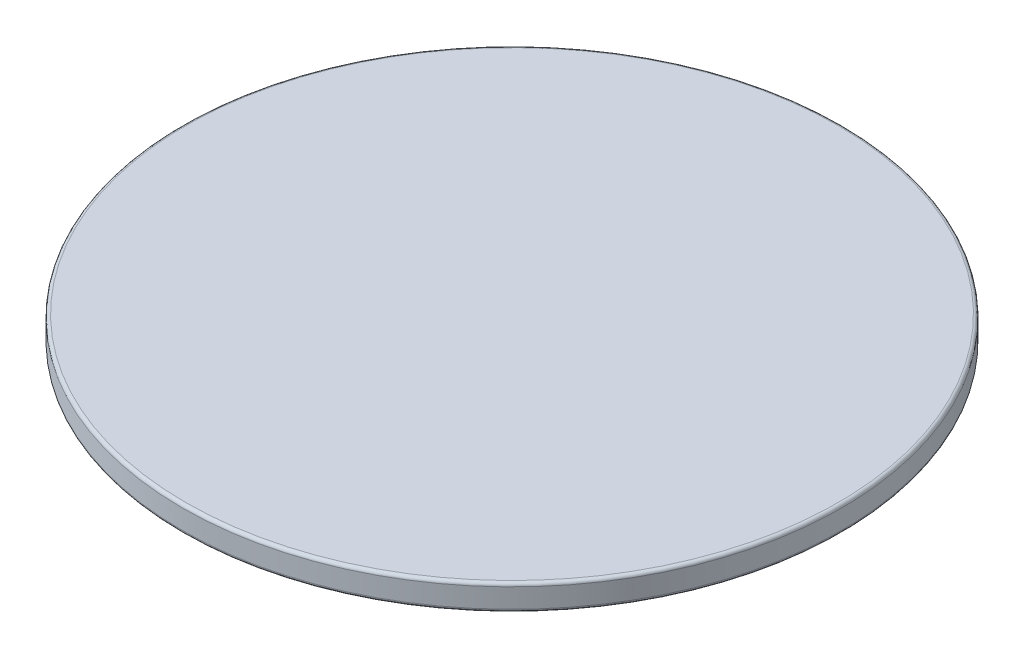
from build123d import *

# Parameters (mm, degrees)
SKETCH2_R           = 64.77
BOSS_EXTRUDE1_DEPTH = 5.08
FILLET1_R           = 0.635


with BuildPart() as part:
    # Sketch2 → Boss-Extrude1 (new body)
    with BuildSketch(Plane(origin=(0, 0, 0), x_dir=(1, 0, 0), z_dir=(0, 1, 0))):
        Circle(SKETCH2_R)
    extrude(amount=BOSS_EXTRUDE1_DEPTH)

    # Fillet1
    fillet1_edges = [part.edges().sort_by_distance(p)[0] for p in [
        (-64.77, 0, 0),
        (-64.77, 5.08, 0),
    ]]
    fillet(fillet1_edges, radius=FILLET1_R)


solid = part.part
